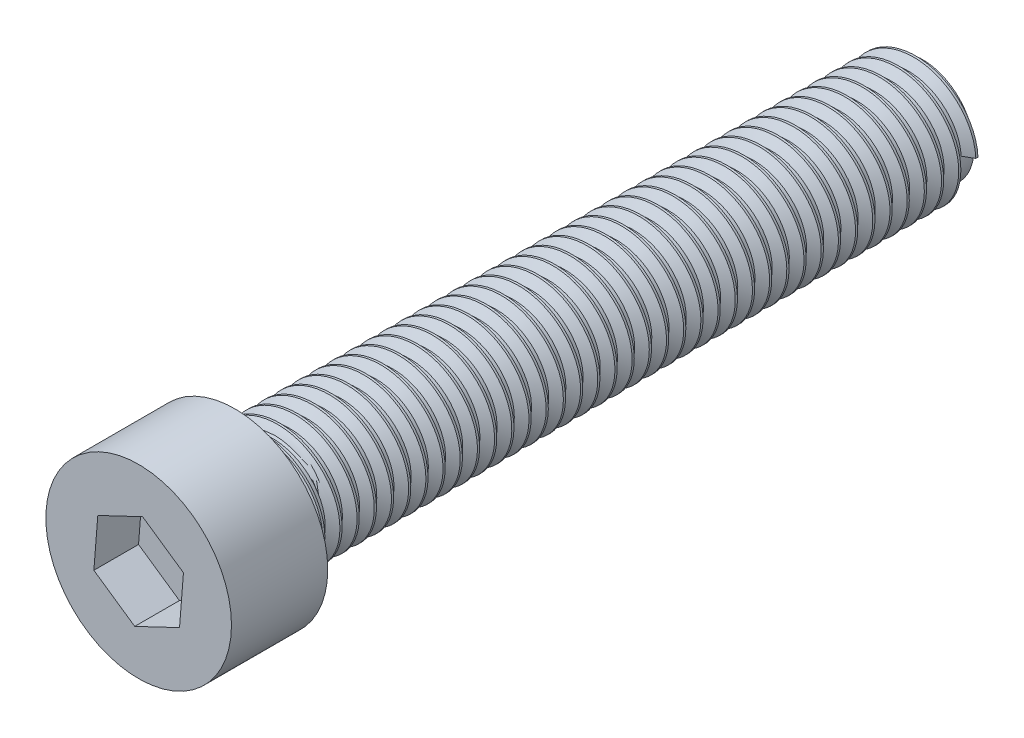
from build123d import *

# Parameters (mm, degrees)
SKETCH1_R           = 2.7
BOSS_EXTRUDE1_DEPTH = 2.8
CUT_EXTRUDE1_DEPTH  = 1.3
SKETCH3_R           = 1.5
BOSS_EXTRUDE2_DEPTH = 20
THREAD1_PITCH       = 0.5


with BuildPart() as part:
    # Sketch1 → Boss-Extrude1 (new body)
    with BuildSketch(Plane.XY):
        Circle(SKETCH1_R)
    extrude(amount=BOSS_EXTRUDE1_DEPTH)

    # Sketch2 → Cut-Extrude1 (cut)
    with BuildSketch(Plane.XY.offset(2.8)):
        Polygon((1.188918816, -0.818416387), (1.30322879, 0.620425704), (0.114309975, 1.438842091), (-1.188918816, 0.818416387), (-1.30322879, -0.620425704), (-0.114309975, -1.438842091), align=None)
    extrude(amount=-CUT_EXTRUDE1_DEPTH, mode=Mode.SUBTRACT)

    # Sketch3 → Boss-Extrude2 (add)
    with BuildSketch(Plane(origin=(0, 0, 0), x_dir=(-1, 0, 0), z_dir=(0, 0, -1))):
        Circle(SKETCH3_R)
    extrude(amount=BOSS_EXTRUDE2_DEPTH)

    # Thread1: arcs per turn and ends read off the stored shape
    # Thread1: the profile of Thread Profile1 profile screwed along a right-hand helix through 40 turns, 6 arcs to a turn; built about Z, then put on its axis
    thread1_z = Axis((0, 0, 0), (0, 0, 1))
    thread1_corners = [(1.4997, 0, -0.000173205), (1.770632938, 0, 0.156249999), (1.770632938, 0, 0.218749999), (1.4997, 0, 0.375173204)]
    with BuildLine(mode=Mode.PRIVATE) as thread1_profile:
        Line(thread1_corners[0], thread1_corners[1])
        Line(thread1_corners[1], thread1_corners[2])
        Line(thread1_corners[2], thread1_corners[3])
        Line(thread1_corners[3], thread1_corners[0])
    thread1_cap = Face(thread1_profile.wire())
    thread1_turn_angles = [0, 30, 60, 90, 120, 150, 180, 210, 240, 270, 300, 330, 360]
    thread1_turn_weights = [1, 0.8660254037844387, 1, 0.8660254037844387, 1, 0.8660254037844387, 1, 0.8660254037844387, 1, 0.8660254037844387, 1, 0.8660254037844387, 1]
    thread1_turn_rails = [Edge.make_bspline([Vector(p[0], p[1], 0).rotate(thread1_z, thread1_turn_angles[k]) / thread1_turn_weights[k] + Vector(0, 0, p[2] + THREAD1_PITCH * thread1_turn_angles[k] / 360) for k in range(13)], [0, 0, 0, 1, 1, 2, 2, 3, 3, 4, 4, 5, 5, 6, 6, 6], 2, thread1_turn_weights) for p in thread1_corners]
    thread1_turn_sides = [Face.make_surface_from_curves(thread1_turn_rails[p[0]], thread1_turn_rails[p[1]]) for p in [(0, 1), (1, 2), (2, 3), (3, 0)]]
    thread1 = Plane(origin=(0, 0, -20), x_dir=(1, 0, 0), z_dir=(0, 0, 1)) * Solid(Shell([*[p.moved(Location((0, 0, THREAD1_PITCH * i))) for i in range(40) for p in thread1_turn_sides], thread1_cap, thread1_cap.rotate(thread1_z, 14400).moved(Location((0, 0, THREAD1_PITCH * 14400 / 360)))]))
    add(thread1)


solid = part.part
